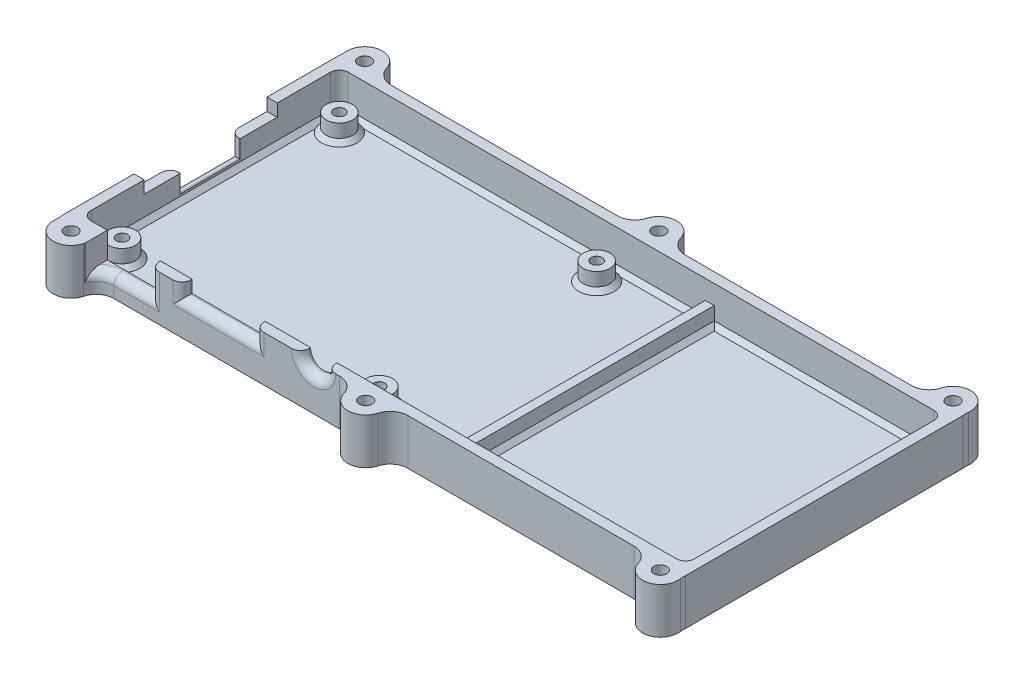
from build123d import *

# Parameters (mm, degrees)
SKETCH3_W                      = 140.6
SKETCH3_H                      = 62.6
SKETCH3_W_2                    = 136
SKETCH3_H_2                    = 58
BOSS_EXTRUDE1_DEPTH            = 10.3
SKETCH5_W                      = 136
SKETCH5_H                      = 58
BOSS_EXTRUDE2_DEPTH            = 2
SKETCH6_R                      = 3
BOSS_EXTRUDE3_DEPTH            = 4
F_2_5_2_5_DIAMETER_HOLE1_D     = 2.5
F_2_5_2_5_DIAMETER_HOLE1_DEPTH = 8
F_2_5_2_5_DIAMETER_HOLE1_TIP   = 0.751075774
SKETCH10_W                     = 2
SKETCH10_H                     = 58
BOSS_EXTRUDE4_DEPTH            = 4
CUT_EXTRUDE1_REACH             = 100.128
SKETCH11_R                     = 3
SKETCH11_W                     = 12
SKETCH11_H                     = 5.8
SKETCH11_W_2                   = 16.5
SKETCH11_H_2                   = 2.8
CUT_EXTRUDE2_REACH             = 147.115
SKETCH12_W                     = 13.5
SKETCH12_H                     = 6.8
SKETCH12_W_2                   = 30
SKETCH12_H_2                   = 2.8
SKETCH13_R                     = 4
BOSS_EXTRUDE5_DEPTH            = 10.3
FILLET2_R                      = 4
FILLET3_R                      = 4
FILLET4_R                      = 4
F_2_9_2_9_DIAMETER_HOLE1_D     = 2.9
FILLET6_R                      = 2
FILLET7_R                      = 2
FILLET8_R                      = 2
CHAMFER1_SIZE                  = 1
CHAMFER2_SIZE                  = 1
FILLET9_R                      = 2


with BuildPart() as part:
    # Sketch3 → Boss-Extrude1 (new body)
    with BuildSketch(Plane(origin=(0, 0, 0), x_dir=(1, 0, 0), z_dir=(0, 1, 0))):
        with Locations((-4.561766162, 3.105993834)):
            Rectangle(SKETCH3_W, SKETCH3_H)
        with Locations((-4.561766162, 3.105993834)):
            Rectangle(SKETCH3_W_2, SKETCH3_H_2, mode=Mode.SUBTRACT)
    extrude(amount=BOSS_EXTRUDE1_DEPTH)

    # Sketch5 → Boss-Extrude2 (add)
    with BuildSketch(Plane(origin=(0, 0, 0), x_dir=(1, 0, 0), z_dir=(0, 1, 0))):
        with Locations((-4.561766162, 3.105993834)):
            Rectangle(SKETCH5_W, SKETCH5_H)
    extrude(amount=BOSS_EXTRUDE2_DEPTH)

    # Sketch6 → Boss-Extrude3 (add)
    with BuildSketch(Plane(origin=(0, 2, 0), x_dir=(1, 0, 0), z_dir=(0, 1, 0))):
        with Locations(Location((-68.061766162, 27.605993834, 0), (0, 0, 270))):
            Circle(SKETCH6_R)
        with Locations(Location((-68.061766162, -21.394006166, 0), (0, 0, 270))):
            Circle(SKETCH6_R)
        with Locations(Location((-10.061766162, -21.394006166, 0), (0, 0, 270))):
            Circle(SKETCH6_R)
        with Locations(Location((-10.061766162, 27.605993834, 0), (0, 0, 270))):
            Circle(SKETCH6_R)
    extrude(amount=BOSS_EXTRUDE3_DEPTH)

    # Ø2.5 (2.5) Diameter Hole1
    with Locations(Plane(origin=(0, 6, 0), x_dir=(1, 0, 0), z_dir=(0, 1, 0))):
        with Locations((-68.061766162, 27.605993834), (-10.061766162, 27.605993834), (-10.061766162, -21.394006166), (-68.061766162, -21.394006166)):
            Hole(F_2_5_2_5_DIAMETER_HOLE1_D / 2, depth=F_2_5_2_5_DIAMETER_HOLE1_DEPTH)
            with Locations((0, 0, -(F_2_5_2_5_DIAMETER_HOLE1_DEPTH + F_2_5_2_5_DIAMETER_HOLE1_TIP / 2))):  # 118° drill point
                Cone(0, F_2_5_2_5_DIAMETER_HOLE1_D / 2, F_2_5_2_5_DIAMETER_HOLE1_TIP, mode=Mode.SUBTRACT)

    # Sketch10 → Boss-Extrude4 (add)
    with BuildSketch(Plane(origin=(0, 2, 0), x_dir=(1, 0, 0), z_dir=(0, 1, 0))):
        with Locations((10.938233838, 3.105993834)):
            Rectangle(SKETCH10_W, SKETCH10_H)
    extrude(amount=BOSS_EXTRUDE4_DEPTH)

    # Sketch11 → Cut-Extrude1 (cut, up to next)
    with BuildSketch(Plane.XY.offset(28.194006166), mode=Mode.PRIVATE) as cut_extrude1_sk1:
        with Locations((-18.061766162, 10.3)):
            Circle(SKETCH11_R)
    cut_extrude1_tool1 = extrude(cut_extrude1_sk1.sketch, amount=-CUT_EXTRUDE1_REACH, mode=Mode.PRIVATE) & part.part
    # Sketch11 → Cut-Extrude1 (cut, up to next)
    with BuildSketch(Plane.XY.offset(28.194006166), mode=Mode.PRIVATE) as cut_extrude1_sk2:
        with Locations((-60.861766162, 7.4)):
            Rectangle(SKETCH11_W, SKETCH11_H)
    cut_extrude1_tool2 = extrude(cut_extrude1_sk2.sketch, amount=-CUT_EXTRUDE1_REACH, mode=Mode.PRIVATE) & part.part
    # Sketch11 → Cut-Extrude1 (cut, up to next)
    with BuildSketch(Plane.XY.offset(28.194006166), mode=Mode.PRIVATE) as cut_extrude1_sk3:
        with Locations((-39.527982648, 8.9)):
            Rectangle(SKETCH11_W_2, SKETCH11_H_2)
    cut_extrude1_tool3 = extrude(cut_extrude1_sk3.sketch, amount=-CUT_EXTRUDE1_REACH, mode=Mode.PRIVATE) & part.part
    add(cut_extrude1_tool1.solids().sort_by_distance((-18.061766, 10.3, 28.194006))[0], mode=Mode.SUBTRACT)
    add(cut_extrude1_tool2.solids().sort_by_distance((-60.861766, 7.4, 28.194006))[0], mode=Mode.SUBTRACT)
    add(cut_extrude1_tool3.solids().sort_by_distance((-39.527983, 8.9, 28.194006))[0], mode=Mode.SUBTRACT)

    # Sketch12 → Cut-Extrude2 (cut, up to next)
    with BuildSketch(Plane.ZY.offset(74.861766162), mode=Mode.PRIVATE) as cut_extrude2_sk1:
        with Locations((-2.982922372, 6.9)):
            Rectangle(SKETCH12_W, SKETCH12_H)
    cut_extrude2_tool1 = extrude(cut_extrude2_sk1.sketch, amount=-CUT_EXTRUDE2_REACH, mode=Mode.PRIVATE) & part.part
    # Sketch12 → Cut-Extrude2 (cut, up to next)
    with BuildSketch(Plane.ZY.offset(74.861766162), mode=Mode.PRIVATE) as cut_extrude2_sk2:
        with Locations((-3.105993834, 8.9)):
            Rectangle(SKETCH12_W_2, SKETCH12_H_2)
    cut_extrude2_tool2 = extrude(cut_extrude2_sk2.sketch, amount=-CUT_EXTRUDE2_REACH, mode=Mode.PRIVATE) & part.part
    add(cut_extrude2_tool1.solids().sort_by_distance((-74.861766, 6.9, -2.982922))[0], mode=Mode.SUBTRACT)
    add(cut_extrude2_tool2.solids().sort_by_distance((-74.861766, 8.9, -3.105994))[0], mode=Mode.SUBTRACT)

    # Sketch13 → Boss-Extrude5 (add)
    with BuildSketch(Plane(origin=(0, 0, 0), x_dir=(1, 0, 0), z_dir=(0, 1, 0))):
        with Locations((-70.861766162, 36.105993834)):
            Circle(SKETCH13_R)
        with Locations((-4.561766162, 36.105993834)):
            Circle(SKETCH13_R)
        with Locations((61.738233838, 36.105993834)):
            Circle(SKETCH13_R)
        with Locations((61.796011733, -29.900958235)):
            Circle(SKETCH13_R)
        with Locations((-4.503886668, -30.017026964)):
            Circle(SKETCH13_R)
        with Locations((-70.80378507, -30.133095693)):
            Circle(SKETCH13_R)
    extrude(amount=BOSS_EXTRUDE5_DEPTH)

    # Fillet2
    # the kernel refuses this fillet: 4 mm, written as the material it adds along each edge
    with BuildSketch(Plane(origin=(-74.48253956, 10.3, -34.405993834), x_dir=(-1, 0, 0), z_dir=(0, -1, 0))) as fillet2_piece_1:
        with BuildLine():
            CenterArc((4.316902517, 0.703355094), FILLET2_R, 172.843462622, 17.284010607)
            Line((0.348064559, 1.201677547), (0.2686878, 1.211643996))
            ThreePointArc((0.2686878, 1.211643996), (0.144462277, 0.609403692), (-0.072415468, 0.034))
            Line((-0.072415468, 0.034), (0, -0.08))
            ThreePointArc((0, -0.08), (0.189613301, -0.08), (0.300473084, -0.014067102))
            Line((0.300473084, -0.014067102), (0.379226602, 0))
        make_face()
    extrude(amount=10.3)

    # Fillet3
    fillet3_edges = [part.edges().sort_by_distance(p)[0] for p in [
        (58.178510574, 5.15, 28.194006166),
        (-67.305223679, 5.15, 28.194006166),
        (-0.943466023, 5.15, 28.194006166),
        (-8.064307313, 5.15, 28.194006166),
        (58.11746044, 5.15, -34.405993834),
        (-8.18253956, 5.15, -34.405993834),
        (-0.940992764, 5.15, -34.405993834),
        (-67.240992764, 5.15, -34.405993834),
    ]]
    fillet(fillet3_edges, radius=FILLET3_R)

    # Fillet4
    # the kernel refuses this fillet: 4 mm, written as the material it adds along each edge
    with BuildSketch(Plane(origin=(-74.30234646, 10.3, 28.194006166), x_dir=(-0.3090485748086473, 0, 0.9510462546105442), z_dir=(0, -1, 0))) as fillet4_piece_1:
        with BuildLine():
            CenterArc((2.288815263, 3.926566562), FILLET4_R, 238.063311662, 20.941030322)
            Line((0.172887862, 0.532034012), (0, 0))
            ThreePointArc((0, 0), (0.762938421, 0.073433438), (1.525876842, 0))
        make_face()
    extrude(amount=10.3)
    with BuildSketch(Plane(origin=(65.413512892, 10.3, 28.194006166), x_dir=(0.29133036394129125, 0, 0.9566225060314203), z_dir=(0, -1, 0))) as fillet4_piece_2:
        with BuildLine():
            CenterArc((1.73706251, -3.957869992), FILLET4_R, 98.323104154, 15.92039244)
            Line((0.094601071, -0.310635365), (0, 0))
            ThreePointArc((0, 0), (0.579020837, -0.042130008), (1.158041673, 0))
        make_face()
    extrude(amount=10.3)
    with BuildSketch(Plane(origin=(65.359007236, 10.3, -34.405993834), x_dir=(1, 0, 0), z_dir=(0, -1, 0))) as fillet4_piece_3:
        with BuildLine():
            CenterArc((4.316902517, -0.703355094), FILLET4_R, 169.87252677, 17.284010607)
            ThreePointArc((0.348064559, -1.201677547), (0.221303822, -0.587146624), (0, 0))
            Line((0, 0), (0.379226602, 0))
        make_face()
    extrude(amount=10.3)

    # Ø2.9 (2.9) Diameter Hole1 (through all)
    with Locations(Plane(origin=(0, 10.3, 0), x_dir=(1, 0, 0), z_dir=(0, 1, 0))):
        with Locations((-70.861766162, 36.105993834), (-4.561766162, 36.105993834), (61.738233838, 36.105993834), (61.796011733, -29.900958235), (-4.503886668, -30.017026964), (-70.80378507, -30.133095693)):
            Hole(F_2_9_2_9_DIAMETER_HOLE1_D / 2)

    # Fillet6
    fillet6_edges = [part.edges().sort_by_distance(p)[0] for p in [
        (63.438233838, 6.15, -32.105993834),
    ]]
    fillet(fillet6_edges, radius=FILLET6_R)

    # Fillet7
    fillet7_edges = [part.edges().sort_by_distance(p)[0] for p in [
        (63.438233838, 6.15, 25.894006166),
    ]]
    fillet(fillet7_edges, radius=FILLET7_R)

    # Fillet8
    fillet8_edges = [part.edges().sort_by_distance(p)[0] for p in [
        (-72.561766162, 6.15, -32.105993834),
        (-72.561766162, 6.15, 25.894006166),
    ]]
    fillet(fillet8_edges, radius=FILLET8_R)

    # Chamfer1
    chamfer1_edges = [part.edges().sort_by_distance(p)[0] for p in [
        (-68.061766162, 2, -30.605993834),
        (-68.061766162, 2, 18.394006166),
        (-10.061766162, 2, 18.394006166),
        (-10.061766162, 2, -30.605993834),
    ]]
    chamfer(chamfer1_edges, length=CHAMFER1_SIZE)

    # Chamfer2
    # the kernel refuses this chamfer: 1 mm, written as the material it adds along each edge
    with BuildSketch(Plane(origin=(9.36655085, 2, -32.105993834), x_dir=(0, 0.9996219169112968, -0.027495876610589075), z_dir=(1, 0, 0)), Plane(origin=(61.438233838, 2, 25.894006166), x_dir=(0, 0.9996219169112968, 0.027495876610585623), z_dir=(-1, 0, 0))) as chamfer2_piece_1:
        Polygon((CHAMFER2_SIZE * 0.999621916911, CHAMFER2_SIZE * 0.0274958766106), (-CHAMFER2_SIZE * 0.0274958766106, CHAMFER2_SIZE * 0.999621916911), (0, 0), align=None)
    extrude(amount=52.071682988)
    with BuildSketch(Plane(origin=(61.438233838, 2, -30.105993834), x_dir=(1, 0, 0), z_dir=(0, 0, 1))) as chamfer2_piece_2:
        Polygon((2 - CHAMFER2_SIZE, 0), (2, CHAMFER2_SIZE), (2, 0), align=None)
    revolve(axis=Axis((61.438233838, 2, -30.105993834), (0, 1, 0)), revolution_arc=90)
    with BuildSketch(Plane(origin=(63.438233838, 2, -30.105993834), x_dir=(-0.9996219169112968, -0.02749587661058639, 0), z_dir=(0, 0, 1)), Plane(origin=(-72.561766162, 2, 23.894006166), x_dir=(0.9996219169112968, -0.027495876610586605, 0), z_dir=(0, 0, -1))) as chamfer2_piece_3:
        Polygon((CHAMFER2_SIZE * 0.999621916911, -CHAMFER2_SIZE * 0.0274958766106), (-CHAMFER2_SIZE * 0.0274958766106, -CHAMFER2_SIZE * 0.999621916911), (0, 0), align=None)
    extrude(amount=54)
    with BuildSketch(Plane(origin=(61.438233838, 2, 23.894006166), x_dir=(1, 0, 0), z_dir=(0, 0, -1))) as chamfer2_piece_4:
        Polygon((2 - CHAMFER2_SIZE, 0), (2, -CHAMFER2_SIZE), (2, 0), align=None)
    revolve(axis=Axis((61.438233838, 2, 23.894006166), (0, -1, 0)), revolution_arc=90)
    with BuildSketch(Plane(origin=(12.509916826, 2, 25.894006166), x_dir=(0, -0.027495876610586296, -0.9996219169112968), z_dir=(-1, 0, 0)), Plane(origin=(-70.561766162, 2, -32.105993834), x_dir=(0, -0.027495876610586296, 0.9996219169112968), z_dir=(1, 0, 0))) as chamfer2_piece_5:
        Polygon((CHAMFER2_SIZE * 0.999621916911, -CHAMFER2_SIZE * 0.0274958766106), (-CHAMFER2_SIZE * 0.0274958766106, -CHAMFER2_SIZE * 0.999621916911), (0, 0), align=None)
    extrude(amount=83.071682988)
    with BuildSketch(Plane(origin=(-70.561766162, 2, -30.105993834), x_dir=(0, 0, -1), z_dir=(1, 0, 0))) as chamfer2_piece_6:
        Polygon((2 - CHAMFER2_SIZE, 0), (2, CHAMFER2_SIZE), (2, 0), align=None)
    revolve(axis=Axis((-70.561766162, 2, -30.105993834), (0, 1, 0)), revolution_arc=90)
    with BuildSketch(Plane(origin=(-70.561766162, 2, 23.894006166), x_dir=(0, 0, 1), z_dir=(1, 0, 0))) as chamfer2_piece_7:
        Polygon((2 - CHAMFER2_SIZE, 0), (2, -CHAMFER2_SIZE), (2, 0), align=None)
    revolve(axis=Axis((-70.561766162, 2, 23.894006166), (0, -1, 0)), revolution_arc=90)
    with BuildSketch(Plane(origin=(9.938233838, 2, 28.465689154), x_dir=(-0.9996219169112968, -0.027495876610586296, 0), z_dir=(0, 0, -1))) as chamfer2_piece_8_section:
        Polygon((CHAMFER2_SIZE * 0.999621916911, CHAMFER2_SIZE * 0.0274958766106), (-CHAMFER2_SIZE * 0.0274958766106, CHAMFER2_SIZE * 0.999621916911), (0, 0), align=None)
    chamfer2_piece_8 = extrude(amount=63.143365976, mode=Mode.PRIVATE)
    chamfer2_piece_8 = split(chamfer2_piece_8, bisect_by=Plane(origin=(9.604900504, 2.333333333, 28.194006166), z_dir=(0, 0, -1)), keep=Keep.TOP, mode=Mode.PRIVATE)
    chamfer2_piece_8 = split(chamfer2_piece_8, bisect_by=Plane(origin=(9.604900504, 2.333333333, -34.405993834), z_dir=(0, 0, 1)), keep=Keep.TOP, mode=Mode.PRIVATE)
    add(chamfer2_piece_8)
    with BuildSketch(Plane(origin=(11.938233838, 2, -34.677676822), x_dir=(-0.027495876610585623, 0.9996219169112968, 0), z_dir=(0, 0, 1))) as chamfer2_piece_9_section:
        Polygon((CHAMFER2_SIZE * 0.999621916911, -CHAMFER2_SIZE * 0.0274958766106), (-CHAMFER2_SIZE * 0.0274958766106, -CHAMFER2_SIZE * 0.999621916911), (0, 0), align=None)
    chamfer2_piece_9 = extrude(amount=63.143365976, mode=Mode.PRIVATE)
    chamfer2_piece_9 = split(chamfer2_piece_9, bisect_by=Plane(origin=(12.271567171, 2.333333333, 28.194006166), z_dir=(0, 0, -1)), keep=Keep.TOP, mode=Mode.PRIVATE)
    chamfer2_piece_9 = split(chamfer2_piece_9, bisect_by=Plane(origin=(12.271567171, 2.333333333, -34.405993834), z_dir=(0, 0, 1)), keep=Keep.TOP, mode=Mode.PRIVATE)
    add(chamfer2_piece_9)

    # Fillet9
    fillet9_edges = [part.edges().sort_by_distance(p)[0] for p in [
        (-54.861766162, 7.4, 28.194006166),
        (-47.777982648, 8.9, 28.194006166),
        (-39.527982648, 7.5, 28.194006166),
        (-31.277982648, 8.9, 28.194006166),
        (-18.061766162, 7.3, 28.194006166),
        (-74.861766162, 5.5, -9.732922372),
        (-74.861766162, 3.5, -2.982922372),
        (-74.861766162, 5.5, 3.767077628),
        (-58.967783765, 4.5, 28.194006166),
        (-65.404021091, 4.5, 28.942840829),
    ]]
    fillet(fillet9_edges, radius=FILLET9_R)


solid = part.part
